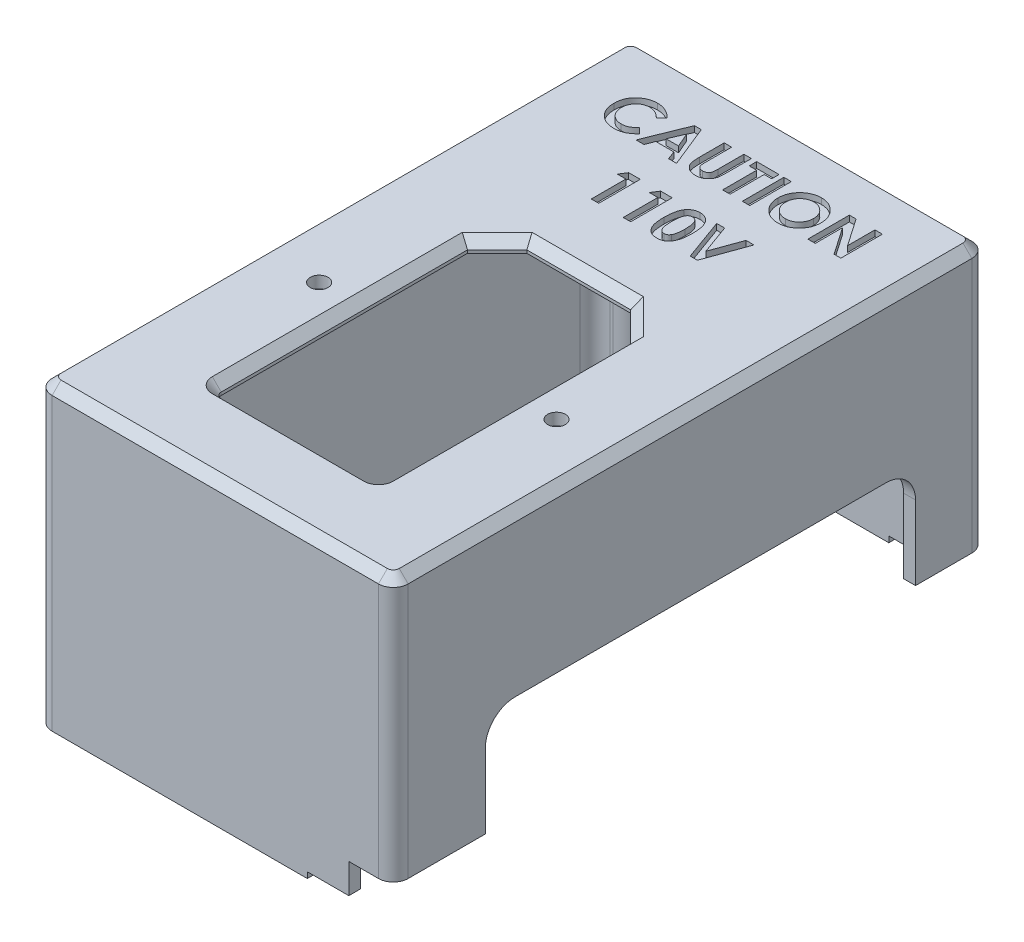
from build123d import *

# Parameters (mm, degrees)
SKETCH1_W           = 60
SKETCH1_H           = 100
SKETCH1_R           = 1.5
BOSS_EXTRUDE1_DEPTH = 2
SKETCH2_W           = 60
SKETCH2_H           = 100
SKETCH2_W_2         = 56
SKETCH2_H_2         = 96
BOSS_EXTRUDE2_DEPTH = 25
BOSS_EXTRUDE3_DEPTH = 17.5
BOSS_EXTRUDE4_DEPTH = 5
FILLET1_R           = 2.5
CHAMFER1_SIZE       = 1.5
CUT_EXTRUDE1_REACH  = 127.922
BOSS_EXTRUDE5_DEPTH = 47.5
SKETCH9_R           = 1.5
CUT_EXTRUDE2_DEPTH  = 42.5
FILLET2_R           = 2.5
WRAP2_START         = -1
WRAP2_OUTLINE_W     = 1.256410257
WRAP2_OUTLINE_H     = 7
WRAP2_DEPTH         = 1
BOSS_EXTRUDE6_START = 1
SKETCH11_R          = 1.5
BOSS_EXTRUDE6_DEPTH = 1
FILLET3_R           = 5


# Read off the part's stored shape, not the designer's step: Wrap2
with BuildPart() as part:
    # Sketch1 → Boss-Extrude1 (new body)
    with BuildSketch(Plane(origin=(0, 0, 0), x_dir=(1, 0, 0), z_dir=(0, 1, 0))):
        with Locations((30, 50)):
            Rectangle(SKETCH1_W, SKETCH1_H)
        with Locations(Location((50, 37.5, 0), (0, 0, 270))):
            Circle(SKETCH1_R, mode=Mode.SUBTRACT)
        with Locations(Location((10, 37.5, 0), (0, 0, 270))):
            Circle(SKETCH1_R, mode=Mode.SUBTRACT)
        with BuildLine():
            Line((16.25, 56.25), (21.25, 61.25))
            Line((21.25, 61.25), (38.75, 61.25))
            Line((38.75, 61.25), (43.75, 56.25))
            Line((43.75, 56.25), (43.75, 14.75))
            ThreePointArc((43.75, 14.75), (43.457106781, 14.042893219), (42.75, 13.75))
            Line((42.75, 13.75), (17.25, 13.75))
            ThreePointArc((17.25, 13.75), (16.542893219, 14.042893219), (16.25, 14.75))
            Line((16.25, 14.75), (16.25, 56.25))
        make_face(mode=Mode.SUBTRACT)
    extrude(amount=BOSS_EXTRUDE1_DEPTH)

    # Sketch2 → Boss-Extrude2 (add)
    with BuildSketch(Plane.XZ):
        with Locations((30, -50)):
            Rectangle(SKETCH2_W, SKETCH2_H)
        with Locations((30, -50)):
            Rectangle(SKETCH2_W_2, SKETCH2_H_2, mode=Mode.SUBTRACT)
    extrude(amount=BOSS_EXTRUDE2_DEPTH)

    # Sketch3 → Boss-Extrude3 (add)
    with BuildSketch(Plane.XZ.offset(25)):
        Polygon((58.450874289, 0), (0, 0), (0, -100), (58, -100), (60, -100), (60, -88), (58, -88), (58, -98), (2, -98), (2, -2), (58, -2), (58, -15.5), (60, -15.5), (60, 0), align=None)
    extrude(amount=BOSS_EXTRUDE3_DEPTH)

    # Sketch5 → Boss-Extrude4 (add)
    with BuildSketch(Plane.XZ.offset(42.5)):
        Polygon((52.5, 0), (0, 0), (0, -2), (0, -98), (0, -100), (52.5, -100), (52.5, -98), (2, -98), (2, -2), (52.5, -2), align=None)
    extrude(amount=BOSS_EXTRUDE4_DEPTH)

    # Fillet1
    fillet1_edges = [part.edges().sort_by_distance(p)[0] for p in [
        (2, -23.75, -2),
        (2, -23.75, -98),
        (0, -22.75, -100),
        (60, -20.25, -100),
        (60, -20.25, 0),
        (0, -22.75, 0),
    ]]
    fillet(fillet1_edges, radius=FILLET1_R)

    # Chamfer1
    chamfer1_edges = [part.edges().sort_by_distance(p)[0] for p in [
        (60, 2, -50),
        (30, 2, 0),
        (0, 2, -50),
        (30, 2, -100),
        (0.732233047, 2, -99.267766953),
        (0.732233047, 2, -0.732233047),
        (59.267766953, 2, -99.267766953),
        (59.267766953, 2, -0.732233047),
        (41.25, 2, -58.75),
        (30, 2, -61.25),
        (18.75, 2, -58.75),
        (16.25, 2, -35.5),
        (16.542893219, 2, -14.042893219),
        (30, 2, -13.75),
        (43.457106781, 2, -14.042893219),
        (43.75, 2, -35.5),
    ]]
    chamfer(chamfer1_edges, length=CHAMFER1_SIZE)

    # Sketch7 → Cut-Extrude1 (cut, up to next)
    with BuildSketch(Plane.ZY, mode=Mode.PRIVATE) as cut_extrude1_sk1:
        with BuildLine():
            Line((-58.75, -47.5), (-58.75, -45))
            ThreePointArc((-58.75, -45), (-58.017766953, -43.232233047), (-56.25, -42.5))
            Line((-56.25, -42.5), (-46.25, -42.5))
            ThreePointArc((-46.25, -42.5), (-44.482233047, -43.232233047), (-43.75, -45))
            Line((-43.75, -45), (-43.75, -47.5))
            Line((-43.75, -47.5), (-58.75, -47.5))
        make_face()
    cut_extrude1_tool1 = extrude(cut_extrude1_sk1.sketch, amount=-CUT_EXTRUDE1_REACH, mode=Mode.PRIVATE) & part.part
    add(cut_extrude1_tool1.solids().sort_by_distance((0, -45.07202, -51.25))[0], mode=Mode.SUBTRACT)

    # Sketch8 → Boss-Extrude5 (add)
    with BuildSketch(Plane.XZ.offset(47.5)):
        with BuildLine():
            Line((5, -92), (2, -92))
            Line((2, -92), (2, -95.5))
            ThreePointArc((2, -95.5), (2.732233047, -97.267766953), (4.5, -98))
            Line((4.5, -98), (8, -98))
            Line((8, -98), (8, -95))
            ThreePointArc((8, -95), (7.121320344, -92.878679656), (5, -92))
        make_face()
        with BuildLine():
            Line((8, -5), (8, -2))
            Line((8, -2), (4.5, -2))
            ThreePointArc((4.5, -2), (2.732233047, -2.732233047), (2, -4.5))
            Line((2, -4.5), (2, -8))
            Line((2, -8), (5, -8))
            ThreePointArc((5, -8), (7.121320344, -7.121320344), (8, -5))
        make_face()
    extrude(amount=-BOSS_EXTRUDE5_DEPTH)

    # Sketch9 → Cut-Extrude2 (cut)
    with BuildSketch(Plane.XZ.offset(47.5)):
        with Locations(Location((5, -5, 0), (0, 0, 270))):
            Circle(SKETCH9_R)
        with Locations(Location((5, -95, 0), (0, 0, 270))):
            Circle(SKETCH9_R)
    extrude(amount=-CUT_EXTRUDE2_DEPTH, mode=Mode.SUBTRACT)

    # Fillet2
    fillet2_edges = [part.edges().sort_by_distance(p)[0] for p in [
        (2, -23.75, -8),
        (8, -23.75, -2),
        (8, -23.75, -98),
        (2, -23.75, -92),
    ]]
    fillet(fillet2_edges, radius=FILLET2_R)

    # Wrap2 outline → Wrap2 (cut)
    # profile 1 of 11: a face of its own
    with BuildSketch(Plane(origin=(0, 2, 0), x_dir=(1, 0, 0), z_dir=(0, 1, 0)).offset(WRAP2_START)):
        with BuildLine():
            add(Edge.make_bspline(
                [(43.596153846, 88.478966346), (43.592880746, 88.353544519), (43.586430998, 88.106396785), (43.536600624, 87.743190399), (43.453381259, 87.394906439), (43.338733521, 87.060756556), (43.188395151, 86.742359259), (43.007255065, 86.437681624), (42.790533321, 86.149551132), (42.546134612, 85.878122407), (42.277072843, 85.631742596), (41.992093717, 85.414620814), (41.692513091, 85.230640009), (41.378769455, 85.079884454), (41.050190002, 84.962888619), (40.707586363, 84.880339557), (40.350979738, 84.830172825), (40.108469939, 84.823765206), (39.985376603, 84.820512821)],
                knots=[0, 0, 0, 0, 0.065722315, 0.129507931, 0.191722103, 0.253161125, 0.314315704, 0.37595174, 0.438619601, 0.502972902, 0.567128646, 0.62955229, 0.690476782, 0.751072338, 0.811667894, 0.872929356, 0.935501371, 1, 1, 1, 1], degree=3))
            add(Edge.make_bspline(
                [(39.975560897, 92.179487179), (40.097264476, 92.176336056), (40.337534907, 92.170115024), (40.690886005, 92.11825787), (41.031405122, 92.033764071), (41.358938277, 91.916311579), (41.672665364, 91.762719183), (41.973693004, 91.57734133), (42.26094293, 91.356679122), (42.531471635, 91.105880246), (42.781488949, 90.833147419), (42.998129097, 90.539502043), (43.182871868, 90.232552764), (43.335987171, 89.911477103), (43.452612974, 89.574051457), (43.534454123, 89.221996252), (43.587033007, 88.855411644), (43.593080388, 88.605817493), (43.596153846, 88.478966346)],
                knots=[0, 0, 0, 0, 0.063395597, 0.125157267, 0.185649467, 0.245976679, 0.306108369, 0.367350588, 0.429902078, 0.494539958, 0.559372583, 0.622409686, 0.684357426, 0.745806601, 0.807430275, 0.869995516, 0.933927868, 1, 1, 1, 1], degree=3))
            add(Edge.make_bspline(
                [(36.326923077, 88.502804487), (36.327990689, 88.585603998), (36.330112394, 88.750154589), (36.355670573, 88.994010164), (36.392467001, 89.233106006), (36.446887172, 89.466488836), (36.512993772, 89.695805061), (36.598644209, 89.918920149), (36.696137586, 90.138217583), (36.810049418, 90.351107186), (36.93670836, 90.555630195), (37.074904543, 90.750821839), (37.224985459, 90.934321967), (37.386467648, 91.107336465), (37.559907598, 91.268728097), (37.743023888, 91.420781585), (37.939367906, 91.55945785), (38.144642297, 91.68814364), (38.357689773, 91.804511969), (38.577643037, 91.90356121), (38.799970617, 91.990059226), (39.027642509, 92.058327284), (39.258218805, 92.113930903), (39.494162744, 92.150702531), (39.733342708, 92.176260001), (39.89462989, 92.1784089), (39.975560897, 92.179487179)],
                knots=[0, 0, 0, 0, 0.043114346, 0.085682765, 0.127594324, 0.169058623, 0.210432029, 0.251811166, 0.29344384, 0.335380853, 0.377476606, 0.418688491, 0.459873034, 0.500872905, 0.541872776, 0.583211777, 0.624763202, 0.666987622, 0.709369706, 0.751102652, 0.79256838, 0.833545109, 0.874827423, 0.916017723, 0.957859204, 1, 1, 1, 1], degree=3))
            add(Edge.make_bspline(
                [(39.985376603, 84.820512821), (39.856635732, 84.82343037), (39.603677519, 84.829162956), (39.233472041, 84.883677235), (38.878783205, 84.965794782), (38.542590601, 85.088350815), (38.221470395, 85.241556163), (37.917781951, 85.430237733), (37.631627329, 85.654083716), (37.364647958, 85.907361332), (37.122764001, 86.184502596), (36.909253963, 86.477277765), (36.72915351, 86.783450294), (36.582456052, 87.103163478), (36.466805669, 87.434430378), (36.385227464, 87.779268505), (36.337037272, 88.136850811), (36.330324658, 88.379727861), (36.326923077, 88.502804487)],
                knots=[0, 0, 0, 0, 0.066748651, 0.131151976, 0.193732197, 0.255325543, 0.316388186, 0.378026863, 0.440405679, 0.504557429, 0.568658287, 0.630986179, 0.692288135, 0.752615447, 0.813199538, 0.874016125, 0.936158356, 1, 1, 1, 1], degree=3))
        make_face()
        with BuildLine():
            add(Edge.make_bspline(
                [(37.583333333, 88.485977564), (37.586176788, 88.390029231), (37.591749488, 88.201986397), (37.630959683, 87.927674577), (37.698044423, 87.668614288), (37.794913483, 87.426072556), (37.915056532, 87.197356136), (38.06425513, 86.985268273), (38.240092968, 86.788539084), (38.375557013, 86.673680389), (38.444310897, 86.615384615)],
                knots=[0, 0, 0, 0, 0.134806833, 0.264199056, 0.388461817, 0.509942098, 0.630409611, 0.750671035, 0.873454726, 1, 1, 1, 1], degree=3))
            add(Edge.make_bspline(
                [(39.955929487, 90.923076923), (39.874022995, 90.920879188), (39.712372354, 90.916541738), (39.475260304, 90.883496239), (39.247624363, 90.83071882), (39.030726405, 90.754271373), (38.823626378, 90.656973176), (38.625957156, 90.539164201), (38.44045605, 90.396794894), (38.264649581, 90.237508431), (38.105837366, 90.060026704), (37.965521765, 89.86982485), (37.848100206, 89.667220503), (37.749758915, 89.454095808), (37.675729719, 89.228054236), (37.623000942, 88.990866394), (37.589678323, 88.742123597), (37.585477965, 88.572555955), (37.583333333, 88.485977564)],
                knots=[0, 0, 0, 0, 0.064608735, 0.12751179, 0.188521308, 0.248708179, 0.308598265, 0.368812249, 0.429887502, 0.492802448, 0.555743332, 0.617485295, 0.678968963, 0.740197691, 0.802360102, 0.866244776, 0.931706828, 1, 1, 1, 1], degree=3))
            add(Edge.make_bspline(
                [(42.33974359, 88.495793269), (42.337529107, 88.579093697), (42.333170237, 88.743057885), (42.300474099, 88.984099473), (42.245587944, 89.215058869), (42.169583572, 89.436313255), (42.072530013, 89.648079541), (41.952513442, 89.849613034), (41.809954982, 90.040718898), (41.648135607, 90.22009482), (41.472005162, 90.384929803), (41.282911531, 90.527976604), (41.086145766, 90.652279726), (40.8771931, 90.749653772), (40.660328529, 90.827231469), (40.434228735, 90.884360798), (40.19803735, 90.916309592), (40.037351467, 90.920801039), (39.955929487, 90.923076923)],
                knots=[0, 0, 0, 0, 0.065939124, 0.129791109, 0.192175236, 0.253617044, 0.314719108, 0.376282275, 0.438972992, 0.503174702, 0.567329465, 0.629650994, 0.690649867, 0.751237613, 0.811754114, 0.872787777, 0.935539633, 1, 1, 1, 1], degree=3))
            add(Edge.make_bspline(
                [(39.981169872, 86.076923077), (40.06166798, 86.079139446), (40.22005054, 86.083500223), (40.452748621, 86.116138914), (40.675680451, 86.171375364), (40.890230008, 86.247152187), (41.095778628, 86.345672047), (41.291321739, 86.467135087), (41.477202181, 86.610049899), (41.652784674, 86.771428142), (41.813275373, 86.949609024), (41.953298165, 87.140825395), (42.074453142, 87.340864187), (42.170749424, 87.552556644), (42.247703347, 87.773904489), (42.299797506, 88.005888025), (42.333401625, 88.247550926), (42.337603166, 88.412011071), (42.33974359, 88.495793269)],
                knots=[0, 0, 0, 0, 0.064147445, 0.126212115, 0.186841289, 0.246935869, 0.307256361, 0.368150502, 0.430070767, 0.493875442, 0.557980682, 0.620869526, 0.682524731, 0.744035698, 0.805888683, 0.868968138, 0.933247429, 1, 1, 1, 1], degree=3))
            add(Edge.make_bspline(
                [(38.444310897, 86.615384615), (38.500633454, 86.572317936), (38.612009612, 86.487154878), (38.789790207, 86.378000948), (38.972869214, 86.284445142), (39.162628193, 86.208853157), (39.358666382, 86.149393772), (39.5609569, 86.107755343), (39.769213116, 86.081623627), (39.91004573, 86.078500392), (39.981169872, 86.076923077)],
                knots=[0, 0, 0, 0, 0.127991026, 0.253098392, 0.376184058, 0.498936312, 0.621525881, 0.745706894, 0.87157535, 1, 1, 1, 1], degree=3))
        make_face(mode=Mode.SUBTRACT)
    # profile 2 of 11: a face of its own
    with BuildSketch(Plane(origin=(0, 2, 0), x_dir=(1, 0, 0), z_dir=(0, 1, 0)).offset(WRAP2_START)):
        with BuildLine():
            add(Edge.make_bspline(
                [(25.019230769, 87.445512821), (25.019299087, 87.398293873), (25.019431041, 87.307090963), (25.026036744, 87.176244648), (25.032081418, 87.055969489), (25.042987725, 86.94639716), (25.059100079, 86.84748079), (25.074702095, 86.758584977), (25.095817881, 86.681301299), (25.127551531, 86.593332239), (25.176442669, 86.494494196), (25.256328075, 86.391482921), (25.348509, 86.29747018), (25.458993149, 86.219217537), (25.58316756, 86.155918201), (25.720349952, 86.109020399), (25.870346946, 86.082951448), (25.974061639, 86.078971545), (26.02744391, 86.076923077)],
                knots=[0, 0, 0, 0, 0.072218748, 0.139489766, 0.200369998, 0.256432726, 0.307803522, 0.353658517, 0.394419906, 0.430155706, 0.496666273, 0.562017618, 0.628754548, 0.697409641, 0.768079195, 0.841338126, 0.918336247, 1, 1, 1, 1], degree=3))
            Line((25.019230769, 87.445512821), (25.019230769, 92))
            Line((25.019230769, 92), (23.762820513, 92))
            Line((23.762820513, 92), (23.762820513, 87.82411859))
            add(Edge.make_bspline(
                [(26.055488782, 84.820512821), (25.995147759, 84.821529185), (25.876096159, 84.823534452), (25.701009896, 84.841215669), (25.531754629, 84.867271134), (25.368648388, 84.905283374), (25.211125061, 84.954388089), (25.059226498, 85.014832573), (24.913517192, 85.086279675), (24.774812512, 85.168072236), (24.643283144, 85.25651681), (24.523072092, 85.354561343), (24.410042609, 85.454955073), (24.307460073, 85.561922992), (24.214553995, 85.674342121), (24.131515716, 85.792467239), (24.058468603, 85.916287852), (23.993575197, 86.048035819), (23.938032775, 86.194407416), (23.891208426, 86.360609139), (23.850301574, 86.549246034), (23.819902015, 86.760743091), (23.792341596, 86.994403239), (23.77489737, 87.250835198), (23.76577151, 87.530046325), (23.763829034, 87.723617611), (23.762820513, 87.82411859)],
                knots=[0, 0, 0, 0, 0.041714932, 0.082302706, 0.121571814, 0.160067124, 0.197993763, 0.235566172, 0.273004881, 0.310090333, 0.346846143, 0.382483572, 0.417271008, 0.451331619, 0.484852741, 0.518030851, 0.551068546, 0.584171, 0.619466744, 0.659157907, 0.703471547, 0.752840114, 0.806844312, 0.866141938, 0.930501747, 1, 1, 1, 1], degree=3))
            add(Edge.make_bspline(
                [(28.33974359, 87.82411859), (28.339569114, 87.739515432), (28.339233615, 87.576831811), (28.334081359, 87.343043998), (28.323113138, 87.129516333), (28.313901098, 86.936186422), (28.296072645, 86.763314714), (28.277499579, 86.610162996), (28.253826609, 86.477274004), (28.218602654, 86.325996036), (28.157816534, 86.151804995), (28.059821339, 85.951231564), (27.935422782, 85.754858025), (27.788389905, 85.564844623), (27.622376338, 85.388328296), (27.441062955, 85.23336981), (27.247330377, 85.102291639), (27.039154237, 84.998298805), (26.816711703, 84.917192234), (26.577801873, 84.862692703), (26.322587664, 84.825872136), (26.146306386, 84.822335068), (26.055488782, 84.820512821)],
                knots=[0, 0, 0, 0, 0.058540417, 0.112567512, 0.161779878, 0.206487156, 0.24645703, 0.281999707, 0.313212938, 0.339806474, 0.389412612, 0.44047348, 0.49395474, 0.549977877, 0.606488084, 0.6613185, 0.714691099, 0.767918471, 0.82193879, 0.878107374, 0.937202655, 1, 1, 1, 1], degree=3))
            Line((28.33974359, 87.82411859), (28.33974359, 92))
            Line((28.33974359, 92), (27.083333333, 92))
            Line((27.083333333, 92), (27.083333333, 87.612379808))
            add(Edge.make_bspline(
                [(26.02744391, 86.076923077), (26.084155985, 86.078577976), (26.19473493, 86.08180475), (26.353785139, 86.113479026), (26.501146059, 86.163915321), (26.633697558, 86.235900768), (26.751307725, 86.322187942), (26.850862267, 86.42058236), (26.929430346, 86.53128027), (26.980638096, 86.633407521), (27.009388726, 86.727406763), (27.030938756, 86.811391518), (27.046737312, 86.910485216), (27.061070281, 87.023140295), (27.069683291, 87.150523645), (27.079022696, 87.291610832), (27.082445675, 87.447367212), (27.083029097, 87.555823303), (27.083333333, 87.612379808)],
                knots=[0, 0, 0, 0, 0.078832604, 0.153710231, 0.224677759, 0.294808775, 0.362714787, 0.427103243, 0.488649766, 0.550900247, 0.585045833, 0.62527219, 0.671465864, 0.724549993, 0.783264732, 0.849073131, 0.921296295, 1, 1, 1, 1], degree=3))
        make_face()
    # profile 3 of 11: a face of its own
    with BuildSketch(Plane(origin=(0, 2, 0), x_dir=(1, 0, 0), z_dir=(0, 1, 0)).offset(WRAP2_START)):
        with BuildLine():
            add(Edge.make_bspline(
                [(34.307692308, 76.099759615), (34.307023777, 75.986631647), (34.305724834, 75.766826032), (34.291729638, 75.446899403), (34.267629249, 75.14624813), (34.236566928, 74.864903318), (34.194020045, 74.603013541), (34.144191731, 74.35990068), (34.084979533, 74.135652858), (34.013493974, 73.930775352), (33.936568465, 73.741967972), (33.851918095, 73.566970465), (33.761018305, 73.40530884), (33.665954065, 73.254544212), (33.561513602, 73.119121045), (33.452780329, 72.994434244), (33.335019804, 72.885233289), (33.2131902, 72.785890453), (33.082828408, 72.700038306), (32.945278812, 72.624953434), (32.798089144, 72.564050685), (32.64394242, 72.511080726), (32.480211179, 72.473054012), (32.309497086, 72.442881063), (32.129872815, 72.426205641), (32.007577376, 72.424136945), (31.944911859, 72.423076923)],
                knots=[0, 0, 0, 0, 0.068490874, 0.13307654, 0.193828987, 0.251082857, 0.304400837, 0.354408344, 0.401294782, 0.444700685, 0.485692492, 0.524676484, 0.562306759, 0.597946585, 0.632473549, 0.665752043, 0.6979853, 0.729586224, 0.760825197, 0.79235508, 0.824312604, 0.857156272, 0.890926887, 0.925960443, 0.962061323, 1, 1, 1, 1], degree=3))
            add(Edge.make_bspline(
                [(31.908453526, 79.782051282), (31.969268997, 79.781148459), (32.088848462, 79.779373268), (32.264966505, 79.760146505), (32.434616873, 79.731100229), (32.598463262, 79.690590801), (32.755326286, 79.636978017), (32.906347628, 79.572804434), (33.049729698, 79.494704014), (33.187301073, 79.406485578), (33.319008763, 79.306609804), (33.441687264, 79.192746263), (33.557576947, 79.067514963), (33.664169226, 78.929022629), (33.763824621, 78.778528996), (33.856215681, 78.616010202), (33.940635128, 78.440670824), (34.018029104, 78.25219445), (34.087235042, 78.047755901), (34.145527117, 77.825010176), (34.195522326, 77.583906409), (34.23772181, 77.323844455), (34.269617799, 77.04447863), (34.291116338, 76.745994531), (34.305869653, 76.428967591), (34.307073716, 76.211489715), (34.307692308, 76.099759615)],
                knots=[0, 0, 0, 0, 0.03663489, 0.072033982, 0.106625971, 0.140305694, 0.17361947, 0.206425673, 0.239067006, 0.271882881, 0.304839889, 0.338529034, 0.372616188, 0.40754825, 0.443718906, 0.481311509, 0.520112998, 0.560912903, 0.604024601, 0.650074564, 0.699572228, 0.752362539, 0.808788717, 0.868954213, 0.93267472, 1, 1, 1, 1], degree=3))
            add(Edge.make_bspline(
                [(30.126201923, 78.829927885), (30.180553967, 78.905645988), (30.286822923, 79.053689799), (30.472637162, 79.24804365), (30.67227037, 79.414264581), (30.889822898, 79.548590863), (31.121854063, 79.654520579), (31.37035597, 79.729337545), (31.634410943, 79.772929396), (31.815741898, 79.778965247), (31.908453526, 79.782051282)],
                knots=[0, 0, 0, 0, 0.132314034, 0.258700009, 0.380911821, 0.500534869, 0.620922618, 0.742375765, 0.868280834, 1, 1, 1, 1], degree=3))
            add(Edge.make_bspline(
                [(29.551282051, 76.033854167), (29.552480767, 76.189089697), (29.554793704, 76.488618653), (29.584104945, 76.921350907), (29.627126412, 77.321336915), (29.690314756, 77.6879076), (29.76844627, 78.022420632), (29.868497742, 78.322672415), (29.982399065, 78.592817606), (30.079457625, 78.752853244), (30.126201923, 78.829927885)],
                knots=[0, 0, 0, 0, 0.161071124, 0.310788808, 0.449903824, 0.578376317, 0.696617212, 0.805987323, 0.906561703, 1, 1, 1, 1], degree=3))
            add(Edge.make_bspline(
                [(31.944911859, 72.423076923), (31.882248033, 72.424157393), (31.75949052, 72.426274016), (31.579380527, 72.442757074), (31.407761735, 72.473176243), (31.242735116, 72.511372667), (31.085449229, 72.563933483), (30.935149893, 72.626658399), (30.792992779, 72.701274779), (30.658584277, 72.787326953), (30.532383296, 72.886005111), (30.412428673, 72.996253779), (30.298985755, 73.117793504), (30.19378029, 73.251985633), (30.095089316, 73.39703898), (30.003942026, 73.554609984), (29.920393195, 73.724469226), (29.841829401, 73.906853471), (29.773567408, 74.105689243), (29.712817404, 74.322752121), (29.663052599, 74.559851502), (29.623028413, 74.816911217), (29.591073126, 75.093386672), (29.567302065, 75.389411315), (29.553229132, 75.705123026), (29.551943811, 75.922127412), (29.551282051, 76.033854167)],
                knots=[0, 0, 0, 0, 0.038217338, 0.074867203, 0.110158082, 0.144453927, 0.178079726, 0.211170773, 0.243687054, 0.275871733, 0.308375516, 0.341263325, 0.375150339, 0.409655261, 0.445157367, 0.482073467, 0.520575756, 0.560553681, 0.603107575, 0.64868871, 0.697947678, 0.750767767, 0.807309402, 0.867655571, 0.931861222, 1, 1, 1, 1], degree=3))
        make_face()
        with BuildLine():
            add(Edge.make_bspline(
                [(30.807692308, 76.019831731), (30.808973791, 75.913252237), (30.811431131, 75.708878155), (30.82430153, 75.414981109), (30.850099175, 75.147511132), (30.882186237, 74.904655481), (30.927253826, 74.687989139), (30.979107004, 74.495462243), (31.043141069, 74.329529042), (31.117144768, 74.18778977), (31.1991072, 74.067212465), (31.288081026, 73.964721213), (31.381037005, 73.875968624), (31.480876596, 73.80387599), (31.587361611, 73.748627519), (31.699603097, 73.708887975), (31.817672382, 73.684561746), (31.89852501, 73.68118848), (31.939302885, 73.679487179)],
                knots=[0, 0, 0, 0, 0.11073428, 0.212341193, 0.305502126, 0.389834841, 0.466690458, 0.535261854, 0.596762914, 0.651065719, 0.701035551, 0.747860271, 0.791833397, 0.834284007, 0.87533389, 0.916034749, 0.957652281, 1, 1, 1, 1], degree=3))
            add(Edge.make_bspline(
                [(31.939302885, 78.525641026), (31.884325194, 78.523035192), (31.776539738, 78.517926376), (31.620137904, 78.474559733), (31.472660741, 78.407577615), (31.360478801, 78.326975108), (31.276511736, 78.249707939), (31.217843344, 78.179783664), (31.161266928, 78.101753213), (31.111295788, 78.012095472), (31.064109988, 77.91403195), (31.017995238, 77.807117498), (30.980193252, 77.688726065), (30.943053803, 77.560873873), (30.91051618, 77.420026147), (30.883256785, 77.265031615), (30.858902912, 77.09488233), (30.841915795, 76.909466847), (30.826078705, 76.708979154), (30.814725928, 76.492972644), (30.809979617, 76.26150559), (30.808470909, 76.102097664), (30.807692308, 76.019831731)],
                knots=[0, 0, 0, 0, 0.053833701, 0.10554263, 0.158054172, 0.211987336, 0.24020689, 0.26979351, 0.301343099, 0.334608061, 0.370284442, 0.408088838, 0.448681346, 0.492069297, 0.538664157, 0.590371054, 0.646387784, 0.707195376, 0.772946775, 0.843642601, 0.919308357, 1, 1, 1, 1], degree=3))
            add(Edge.make_bspline(
                [(33.051282051, 76.099759615), (33.05082036, 76.210093698), (33.049931683, 76.422467973), (33.033627029, 76.727356228), (33.010921552, 77.005821048), (32.977709995, 77.257240735), (32.93497729, 77.482225625), (32.88230907, 77.680761011), (32.820217157, 77.853238168), (32.746583547, 77.999485112), (32.66502975, 78.123774954), (32.578457904, 78.230405996), (32.486501949, 78.321444891), (32.389315665, 78.397234232), (32.284649642, 78.455142972), (32.174503137, 78.496031334), (32.058650341, 78.520767421), (31.979622333, 78.523994564), (31.939302885, 78.525641026)],
                knots=[0, 0, 0, 0, 0.112114796, 0.215801843, 0.310202692, 0.395992925, 0.473410231, 0.54277842, 0.604548022, 0.659357266, 0.708764362, 0.755355506, 0.798686994, 0.840016839, 0.880203447, 0.919733348, 0.959048606, 1, 1, 1, 1], degree=3))
            add(Edge.make_bspline(
                [(32.706330128, 74.160456731), (32.734640354, 74.212236481), (32.794004603, 74.320814418), (32.862701014, 74.504035638), (32.920525824, 74.710678891), (32.970294792, 74.941387272), (33.00433373, 75.197070723), (33.033648023, 75.476107932), (33.047787034, 75.779904019), (33.050086821, 75.990375043), (33.051282051, 76.099759615)],
                knots=[0, 0, 0, 0, 0.088870731, 0.186354716, 0.294077654, 0.412236528, 0.541778144, 0.682702607, 0.835096353, 1, 1, 1, 1], degree=3))
            add(Edge.make_bspline(
                [(31.939302885, 73.679487179), (31.978681391, 73.680651336), (32.055779611, 73.682930609), (32.168206082, 73.70632704), (32.274524542, 73.744364556), (32.374413982, 73.798171293), (32.468231692, 73.866594791), (32.55551915, 73.949935733), (32.635618051, 74.049024834), (32.682284034, 74.122563601), (32.706330128, 74.160456731)],
                knots=[0, 0, 0, 0, 0.124035433, 0.242845955, 0.360341682, 0.479042432, 0.59933411, 0.725488476, 0.858549429, 1, 1, 1, 1], degree=3))
        make_face(mode=Mode.SUBTRACT)
    # profile 4 of 11: a face of its own
    with BuildSketch(Plane(origin=(0, 2, 0), x_dir=(1, 0, 0), z_dir=(0, 1, 0)).offset(WRAP2_START)):
        with BuildLine():
            add(Edge.make_bspline(
                [(14.405649038, 89.905048077), (14.327499069, 89.985855276), (14.174847695, 90.143697053), (13.928868885, 90.352665654), (13.673059879, 90.526812709), (13.41239693, 90.67347825), (13.142191468, 90.784441185), (12.865567804, 90.865301745), (12.580759613, 90.914599372), (12.388012384, 90.920239893), (12.291065705, 90.923076923)],
                knots=[0, 0, 0, 0, 0.139406438, 0.272304448, 0.399525336, 0.522810878, 0.642662717, 0.761022621, 0.879800797, 1, 1, 1, 1], degree=3))
            Line((14.405649038, 89.905048077), (15.326923077, 90.785657051))
            add(Edge.make_bspline(
                [(12.340144231, 92.179487179), (12.410759195, 92.178429383), (12.551254925, 92.176324789), (12.760476643, 92.158780708), (12.968025104, 92.131227907), (13.17315722, 92.089656597), (13.377340306, 92.040306198), (13.577891168, 91.975688659), (13.777973603, 91.903660234), (13.974449616, 91.817564959), (14.16759346, 91.723584189), (14.352880434, 91.616959594), (14.53342149, 91.50425273), (14.705215946, 91.378793112), (14.871481884, 91.245131394), (15.031349883, 91.102643969), (15.183417009, 90.948955153), (15.278845893, 90.840364932), (15.326923077, 90.785657051)],
                knots=[0, 0, 0, 0, 0.062275778, 0.123904062, 0.185067241, 0.246840152, 0.30843533, 0.370241251, 0.432586589, 0.495924582, 0.559351071, 0.621942654, 0.684392867, 0.746985808, 0.809441465, 0.872507833, 0.935769297, 1, 1, 1, 1], degree=3))
            add(Edge.make_bspline(
                [(8.685897436, 88.511217949), (8.687050453, 88.597281987), (8.68933545, 88.767839876), (8.713350985, 89.019085465), (8.746830037, 89.264004974), (8.799941508, 89.500055325), (8.863962149, 89.730416554), (8.943580227, 89.952584902), (9.038668581, 90.167198903), (9.14616229, 90.374617834), (9.267768847, 90.57348288), (9.403616722, 90.762085475), (9.550208659, 90.941881597), (9.711067026, 91.110485917), (9.883854338, 91.269378814), (10.06935071, 91.417699216), (10.266440475, 91.557574206), (10.475657082, 91.685396746), (10.692936008, 91.801019028), (10.915536796, 91.903002819), (11.14291254, 91.988237783), (11.374101876, 92.058937041), (11.610081576, 92.111709039), (11.849167276, 92.151655738), (12.093393309, 92.173986199), (12.257369931, 92.177641837), (12.340144231, 92.179487179)],
                knots=[0, 0, 0, 0, 0.044663331, 0.088511806, 0.130925591, 0.172904037, 0.21400012, 0.25498502, 0.295291276, 0.335772442, 0.376180821, 0.416178408, 0.456350051, 0.496512167, 0.537040574, 0.578118744, 0.619724561, 0.66242197, 0.705298954, 0.747430001, 0.789432984, 0.831267421, 0.872825096, 0.91487011, 0.957027003, 1, 1, 1, 1], degree=3))
            add(Edge.make_bspline(
                [(12.320512821, 84.820512821), (12.189960293, 84.823840865), (11.934505285, 84.830352922), (11.560142632, 84.87860286), (11.20450816, 84.959493031), (10.866736678, 85.073894043), (10.54693559, 85.220035975), (10.245186709, 85.399199122), (9.961976389, 85.610907474), (9.699592411, 85.852679606), (9.462253615, 86.119696628), (9.252473605, 86.406399657), (9.078943573, 86.714197732), (8.934857848, 87.038543692), (8.822184706, 87.380917655), (8.742881915, 87.741689965), (8.693976463, 88.120512273), (8.688626137, 88.379256642), (8.685897436, 88.511217949)],
                knots=[0, 0, 0, 0, 0.067376243, 0.131836579, 0.194461068, 0.255345968, 0.31558834, 0.375627452, 0.436137852, 0.49777862, 0.559470361, 0.62027777, 0.680787689, 0.741491622, 0.803215436, 0.866492763, 0.931910443, 1, 1, 1, 1], degree=3))
            add(Edge.make_bspline(
                [(15.298878205, 86.156850962), (15.236089003, 86.096229958), (15.113537907, 85.977910722), (14.928672982, 85.809908449), (14.744040716, 85.658939731), (14.564101441, 85.519525064), (14.385907564, 85.395725937), (14.209477982, 85.28741871), (14.036809955, 85.191864136), (13.864317975, 85.110673698), (13.69092871, 85.041734583), (13.512531532, 84.982382529), (13.328581064, 84.932172828), (13.137953821, 84.891660193), (12.942427858, 84.859174528), (12.740173311, 84.837246893), (12.532472574, 84.822505673), (12.391585946, 84.821181052), (12.320512821, 84.820512821)],
                knots=[0, 0, 0, 0, 0.077782936, 0.151815657, 0.222539839, 0.290277535, 0.354640607, 0.415797753, 0.474709008, 0.5304261, 0.585579746, 0.640906165, 0.697901091, 0.755420321, 0.814521258, 0.874461831, 0.936669717, 1, 1, 1, 1], degree=3))
            Line((15.298878205, 86.156850962), (14.405649038, 87.094951923))
            add(Edge.make_bspline(
                [(12.314903846, 86.076923077), (12.40853548, 86.079631401), (12.592497293, 86.084952553), (12.862487704, 86.126563207), (13.119761669, 86.195010378), (13.325322335, 86.27584251), (13.486373688, 86.355665289), (13.608979701, 86.42949743), (13.735763876, 86.512086785), (13.864620433, 86.606550367), (13.996998756, 86.711754575), (14.130562059, 86.830003577), (14.268729589, 86.957403603), (14.359241768, 87.048331504), (14.405649038, 87.094951923)],
                knots=[0, 0, 0, 0, 0.117048429, 0.229969726, 0.340703508, 0.449355147, 0.505556512, 0.56530267, 0.628204956, 0.694728992, 0.765018834, 0.839580202, 0.9177498, 1, 1, 1, 1], degree=3))
            add(Edge.make_bspline(
                [(9.942307692, 88.514022436), (9.942982304, 88.455565852), (9.944311977, 88.340346725), (9.958867599, 88.169905657), (9.982305584, 88.004537527), (10.016226155, 87.844492824), (10.058644162, 87.689632851), (10.108410143, 87.538621639), (10.170840834, 87.393545824), (10.240139843, 87.252720443), (10.320733791, 87.119988094), (10.407628936, 86.993416783), (10.501852533, 86.87362695), (10.604014874, 86.761108301), (10.715553768, 86.657619248), (10.833586346, 86.560047755), (10.960103655, 86.470836364), (11.092477609, 86.387746219), (11.231851753, 86.315565103), (11.374444543, 86.250182957), (11.522417972, 86.197082934), (11.673970376, 86.154279471), (11.828560159, 86.117881518), (11.987699354, 86.09547018), (12.150008422, 86.078498336), (12.259702108, 86.077450423), (12.314903846, 86.076923077)],
                knots=[0, 0, 0, 0, 0.045985853, 0.090639062, 0.134485273, 0.177331356, 0.219264833, 0.260785002, 0.302316572, 0.343435729, 0.384181474, 0.424375739, 0.464181122, 0.504011983, 0.543822462, 0.583802465, 0.624418535, 0.66554756, 0.70667494, 0.747826979, 0.788895117, 0.830219358, 0.871706937, 0.913733854, 0.956587828, 1, 1, 1, 1], degree=3))
            add(Edge.make_bspline(
                [(12.291065705, 90.923076923), (12.210103447, 90.92083557), (12.05033335, 90.916412506), (11.81574898, 90.883987086), (11.591356907, 90.828846247), (11.376389, 90.752851958), (11.171477813, 90.654519381), (10.976193723, 90.533924623), (10.791018195, 90.392156826), (10.618397291, 90.229949504), (10.460489755, 90.052725815), (10.320968392, 89.863628562), (10.20409687, 89.663090955), (10.108182313, 89.453143893), (10.033468581, 89.232815637), (9.980113589, 89.002254519), (9.949254488, 88.76118596), (9.94464856, 88.59730935), (9.942307692, 88.514022436)],
                knots=[0, 0, 0, 0, 0.064714517, 0.127706968, 0.188882163, 0.249158299, 0.309661029, 0.370224886, 0.432332222, 0.495781859, 0.559304077, 0.621860558, 0.683321537, 0.744522975, 0.806088371, 0.868994315, 0.933419057, 1, 1, 1, 1], degree=3))
        make_face()
    # profile 5 of 11: a face of its own
    with BuildSketch(Plane(origin=(0, 2, 0), x_dir=(1, 0, 0), z_dir=(0, 1, 0)).offset(WRAP2_START)):
        Polygon((50.416666667, 85), (50.416666667, 92), (49.16025641, 92), (49.16025641, 87.393629808), (45.984174679, 92), (44.852564103, 92), (44.852564103, 85), (46.108974359, 85), (46.108974359, 89.592347756), (49.276642628, 85), align=None)
    # profile 6 of 11: a face of its own
    with BuildSketch(Plane(origin=(0, 2, 0), x_dir=(1, 0, 0), z_dir=(0, 1, 0)).offset(WRAP2_START)):
        with Locations((34.442307693, 88.5)):
            Rectangle(WRAP2_OUTLINE_W, WRAP2_OUTLINE_H)
    # profile 7 of 11: a face of its own
    with BuildSketch(Plane(origin=(0, 2, 0), x_dir=(1, 0, 0), z_dir=(0, 1, 0)).offset(WRAP2_START)):
        Polygon((33.006410256, 90.743589744), (33.006410256, 92), (29.237179487, 92), (29.237179487, 90.743589744), (30.493589744, 90.743589744), (30.493589744, 85), (31.75, 85), (31.75, 90.743589744), align=None)
    # profile 8 of 11: a face of its own
    with BuildSketch(Plane(origin=(0, 2, 0), x_dir=(1, 0, 0), z_dir=(0, 1, 0)).offset(WRAP2_START)):
        Polygon((22.730769231, 85), (19.903846154, 92), (18.738581731, 92), (15.91025641, 85), (17.250801282, 85), (17.794871795, 86.435897436), (20.844751603, 86.435897436), (21.388822115, 85), align=None)
        Polygon((19.320512821, 90.122395833), (20.369391026, 87.692307692), (18.271634615, 87.692307692), align=None, mode=Mode.SUBTRACT)
    # profile 9 of 11: a face of its own
    with BuildSketch(Plane(origin=(0, 2, 0), x_dir=(1, 0, 0), z_dir=(0, 1, 0)).offset(WRAP2_START)):
        Polygon((26.141025641, 72.602564103), (27.397435897, 72.602564103), (27.397435897, 79.602564103), (25.455328526, 79.602564103), (24.705128205, 78.435897436), (26.141025641, 78.435897436), align=None)
    # profile 10 of 11: a face of its own
    with BuildSketch(Plane(origin=(0, 2, 0), x_dir=(1, 0, 0), z_dir=(0, 1, 0)).offset(WRAP2_START)):
        Polygon((20.756410256, 78.435897436), (20.756410256, 72.602564103), (22.012820513, 72.602564103), (22.012820513, 79.602564103), (20.070713141, 79.602564103), (19.320512821, 78.435897436), align=None)
    # profile 11 of 11: a face of its own
    with BuildSketch(Plane(origin=(0, 2, 0), x_dir=(1, 0, 0), z_dir=(0, 1, 0)).offset(WRAP2_START)):
        Polygon((34.891025641, 79.602564103), (37.424879808, 72.602564103), (38.635016026, 72.602564103), (41.173076923, 79.602564103), (39.835336538, 79.602564103), (38.032051282, 74.630208333), (36.232972756, 79.602564103), align=None)
    extrude(amount=WRAP2_DEPTH, mode=Mode.SUBTRACT)

    # Sketch11 → Boss-Extrude6 (add)
    # profile 1 of 2: a face of its own
    with BuildSketch(Plane.XZ.offset(47.5).offset(BOSS_EXTRUDE6_START)):
        with BuildLine():
            Line((2, -43.75), (2, -10.5))
            ThreePointArc((2, -10.5), (2.732233047, -8.732233047), (4.5, -8))
            Line((4.5, -8), (5, -8))
            ThreePointArc((5, -8), (7.121320344, -7.121320344), (8, -5))
            Line((8, -5), (8, -4.5))
            ThreePointArc((8, -4.5), (8.732233047, -2.732233047), (10.5, -2))
            Line((10.5, -2), (45.5, -2))
            Line((45.5, -2), (45.5, 0))
            Line((45.5, 0), (2.5, 0))
            ThreePointArc((2.5, 0), (0.732233047, -0.732233047), (0, -2.5))
            Line((0, -2.5), (0, -43.75))
            Line((0, -43.75), (2, -43.75))
        make_face()
        with Locations(Location((5, -5, 0), (0, 0, 270))):
            Circle(SKETCH11_R, mode=Mode.SUBTRACT)
    # profile 2 of 2: a face of its own
    with BuildSketch(Plane.XZ.offset(47.5).offset(BOSS_EXTRUDE6_START)):
        with BuildLine():
            Line((5, -92), (4.5, -92))
            ThreePointArc((4.5, -92), (2.732233047, -91.267766953), (2, -89.5))
            Line((2, -89.5), (2, -58.75))
            Line((2, -58.75), (0, -58.75))
            Line((0, -58.75), (0, -97.5))
            ThreePointArc((0, -97.5), (0.732233047, -99.267766953), (2.5, -100))
            Line((2.5, -100), (45.5, -100))
            Line((45.5, -100), (45.5, -98))
            Line((45.5, -98), (10.5, -98))
            ThreePointArc((10.5, -98), (8.732233047, -97.267766953), (8, -95.5))
            Line((8, -95.5), (8, -95))
            ThreePointArc((8, -95), (7.121320344, -92.878679656), (5, -92))
        make_face()
        with Locations(Location((5, -95, 0), (0, 0, 270))):
            Circle(SKETCH11_R, mode=Mode.SUBTRACT)
    extrude(amount=-BOSS_EXTRUDE6_DEPTH)

    # Fillet3
    fillet3_edges = [part.edges().sort_by_distance(p)[0] for p in [
        (59, -25, -88),
        (59, -25, -15.5),
    ]]
    fillet(fillet3_edges, radius=FILLET3_R)


solid = part.part
